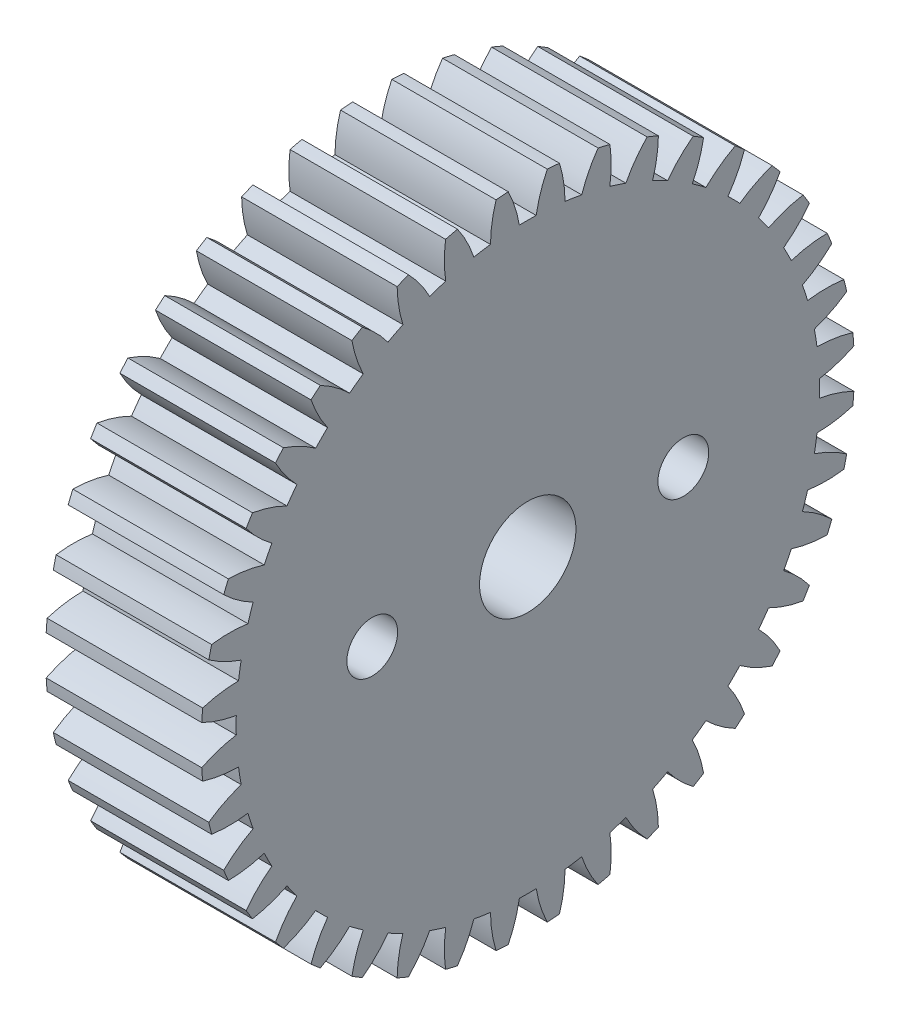
from build123d import *

# Parameters (mm, degrees)
BASPROSKE_W           = 10
BASPROSKE_H           = 21
TOOTHCUT_DEPTH        = 32.336879232
TEETHCUTS_COUNT       = 40
TEETHCUTS_ANGLE       = 351
BORSKE_R              = 3
BORE_DEPTH            = 50.0000508
F_4_CLEARANCE_HOLE1_D = 3.2639
SKETCH3_R             = 3.1
CUT_EXTRUDE1_DEPTH    = 32.286503812


with BuildPart() as part:
    # BasProSke → Base-Revolve (revolve)
    with BuildSketch(Plane(origin=(0, 0, 0), x_dir=(1, 0, 0), z_dir=(0, 1, 0))):
        with Locations((5, 10.5)):
            Rectangle(BASPROSKE_W, BASPROSKE_H)
    revolve(axis=Axis((-10, 0, 0), (1, 0, 0)))

    # TooCutSke → ToothCut (cut, through all)
    with BuildSketch(Plane(origin=(0, 0, 0), x_dir=(0, 0, -1), z_dir=(1, 0, 0))):
        with BuildLine():
            ThreePointArc((0.541912224, 18.741166776), (0, 18.749), (-0.541912224, 18.741166776))
            ThreePointArc((-0.541912224, 18.741166776), (-0.82173342, 19.891076163), (-1.268136615, 20.987121639))
            ThreePointArc((-1.268136615, 20.987121639), (0, 21.0254), (1.268136615, 20.987121639))
            ThreePointArc((1.268136615, 20.987121639), (0.82173342, 19.891076163), (0.541912224, 18.741166776))
        make_face()
    toothcut = extrude(amount=TOOTHCUT_DEPTH, mode=Mode.SUBTRACT)

    # TeethCuts: ToothCut ×40 about axis
    teethcuts_axis = Axis((-10, 0, 0), (1, 0, 0))
    for i in range(1, TEETHCUTS_COUNT):
        add(toothcut.rotate(teethcuts_axis, i * TEETHCUTS_ANGLE / (TEETHCUTS_COUNT - 1)), mode=Mode.SUBTRACT)

    # BorSke → Bore (cut, symmetric)
    with BuildSketch(Plane(origin=(0, 0, 0), x_dir=(0, 0, -1), z_dir=(1, 0, 0))):
        Circle(BORSKE_R)
    extrude(amount=BORE_DEPTH, both=True, mode=Mode.SUBTRACT)

    # #4 Clearance Hole1 (through all)
    with Locations(Plane(origin=(10, 0, 0), x_dir=(0, 0, -1), z_dir=(1, 0, 0))):
        with Locations((-10, 0), (10, 0)):
            Hole(F_4_CLEARANCE_HOLE1_D / 2)

    # Sketch3 → Cut-Extrude1 (cut, through all)
    with BuildSketch(Plane(origin=(10, 0, 0), x_dir=(0, 0, -1), z_dir=(1, 0, 0))):
        Circle(SKETCH3_R)
    extrude(amount=-CUT_EXTRUDE1_DEPTH, mode=Mode.SUBTRACT)


solid = part.part
